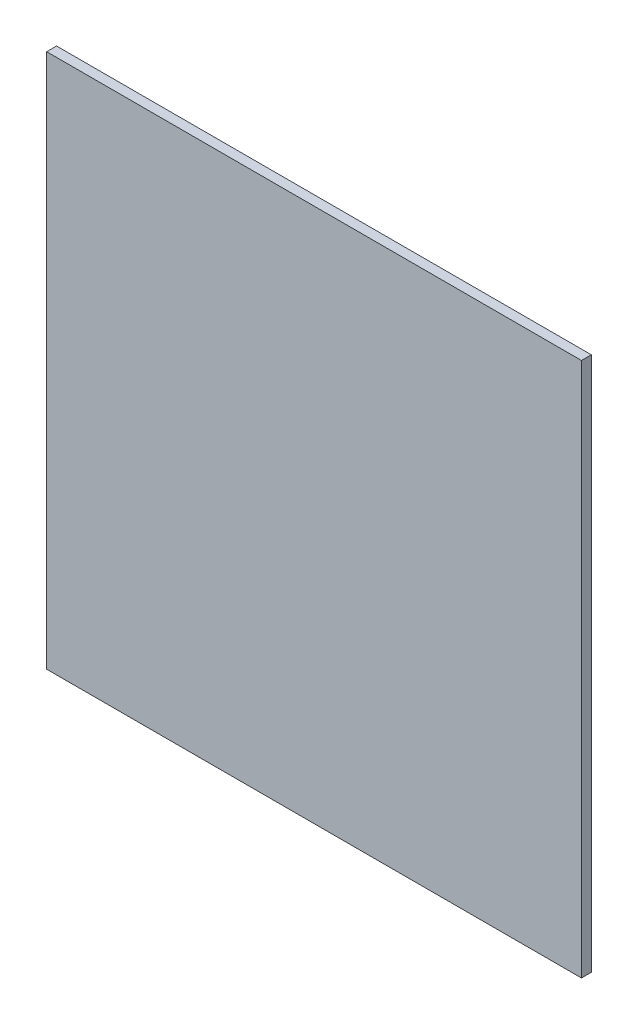
from build123d import *

# Parameters (mm, degrees)
SKETCH1_W         = 650
SKETCH1_H         = 650
BENCH_PLATE_DEPTH = 12


with BuildPart() as part:
    # Sketch1 → Bench_Plate (new body)
    with BuildSketch(Plane.XY):
        Rectangle(SKETCH1_W, SKETCH1_H)
    extrude(amount=BENCH_PLATE_DEPTH)


solid = part.part
